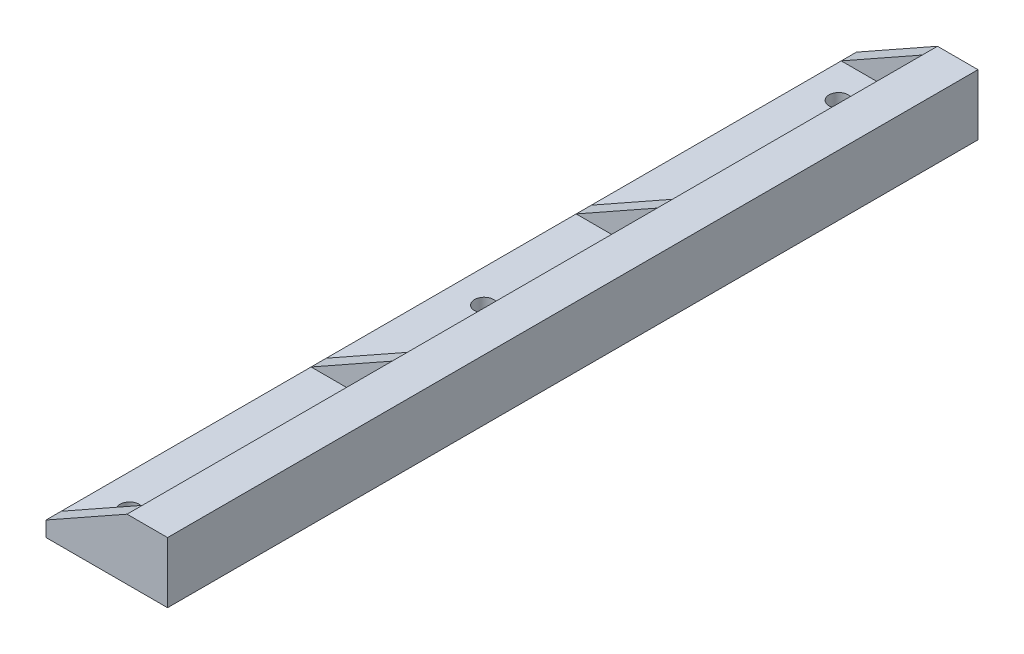
from build123d import *

# Parameters (mm, degrees)
BOSS_EXTRUDE1_DEPTH             = 160
RIB3_REACH                      = 111.505
SKETCH4_WALL_W                  = 239.367706636
SKETCH4_WALL_H                  = 3
RIB4_REACH                      = 164.234
SKETCH5_WALL_W                  = 344.826356402
SKETCH5_WALL_H                  = 3
F_6_CLEARANCE_HOLE1_D           = 3.7973
TAP_DRILL_FOR_M3X0_5_TAP1_D     = 2.5
TAP_DRILL_FOR_M3X0_5_TAP1_DEPTH = 5
TAP_DRILL_FOR_M3X0_5_TAP1_TIP   = 0.751075774


with BuildPart() as part:
    # Sketch1 → Boss-Extrude1 (new body)
    with BuildSketch(Plane.XY):
        with BuildLine():
            Line((0, 0), (0, 12))
            Line((0, 12), (-8, 12))
            Line((-8, 12), (-8, 6))
            ThreePointArc((-8, 6), (-8.878679656, 3.878679656), (-11, 3))
            Line((-11, 3), (-24, 3))
            Line((-24, 3), (-24, 0))
            Line((-24, 0), (0, 0))
        make_face()
    extrude(amount=BOSS_EXTRUDE1_DEPTH)

    # Sketch4 wall → Rib3 (add, up to next)
    with BuildSketch(Plane(origin=(-16, 7.5, 53.83333334), x_dir=(-0.871575537125, -0.490261239633, 0), z_dir=(-0.490261239633, 0.871575537125, 0)), mode=Mode.PRIVATE) as rib3_sk1:
        Rectangle(SKETCH4_WALL_W, SKETCH4_WALL_H)
    rib3_tool1 = extrude(rib3_sk1.sketch, amount=-RIB3_REACH, mode=Mode.PRIVATE) - part.part
    rib3 = rib3_tool1.solids().sort_by_distance((-16, 7.5, 53.83333334))[0]
    add(rib3)

    # Sketch5 wall → Rib4 (add, up to next)
    with BuildSketch(Plane(origin=(-16, 7.5, 0), x_dir=(-0.871575537125, -0.490261239633, 0), z_dir=(-0.490261239633, 0.871575537125, 0)), mode=Mode.PRIVATE) as rib4_sk1:
        with Locations((0, 1.5)):
            Rectangle(SKETCH5_WALL_W, SKETCH5_WALL_H)
    rib4_tool1 = extrude(rib4_sk1.sketch, amount=-RIB4_REACH, mode=Mode.PRIVATE) - part.part
    rib4 = rib4_tool1.solids().sort_by_distance((-16, 7.5, 0))[0]
    add(rib4)

    # Mirror1: Rib3, Rib4 across plane
    add(rib3.mirror(Plane(origin=(0, 0, 80), x_dir=(1, 0, 0), z_dir=(0, 0, -1))))
    add(rib4.mirror(Plane(origin=(0, 0, 80), x_dir=(1, 0, 0), z_dir=(0, 0, -1))))

    # #6 Clearance Hole1 (through all)
    with Locations(Plane(origin=(0, 0, 0), x_dir=(-1, 0, 0), z_dir=(0, -1, 0))):
        with Locations((17.49975, -10), (17.49975, -80), (17.49975, -150)):
            Hole(F_6_CLEARANCE_HOLE1_D / 2)

    # Tap Drill for M3x0.5 Tap1
    with Locations(Plane(origin=(0, 0, 0), x_dir=(-1, 0, 0), z_dir=(0, -1, 0))):
        with Locations((4.249875, -42.33333334), (4.249875, -117.66666666)):
            Hole(TAP_DRILL_FOR_M3X0_5_TAP1_D / 2, depth=TAP_DRILL_FOR_M3X0_5_TAP1_DEPTH)
            with Locations((0, 0, -(TAP_DRILL_FOR_M3X0_5_TAP1_DEPTH + TAP_DRILL_FOR_M3X0_5_TAP1_TIP / 2))):  # 118° drill point
                Cone(0, TAP_DRILL_FOR_M3X0_5_TAP1_D / 2, TAP_DRILL_FOR_M3X0_5_TAP1_TIP, mode=Mode.SUBTRACT)


solid = part.part
